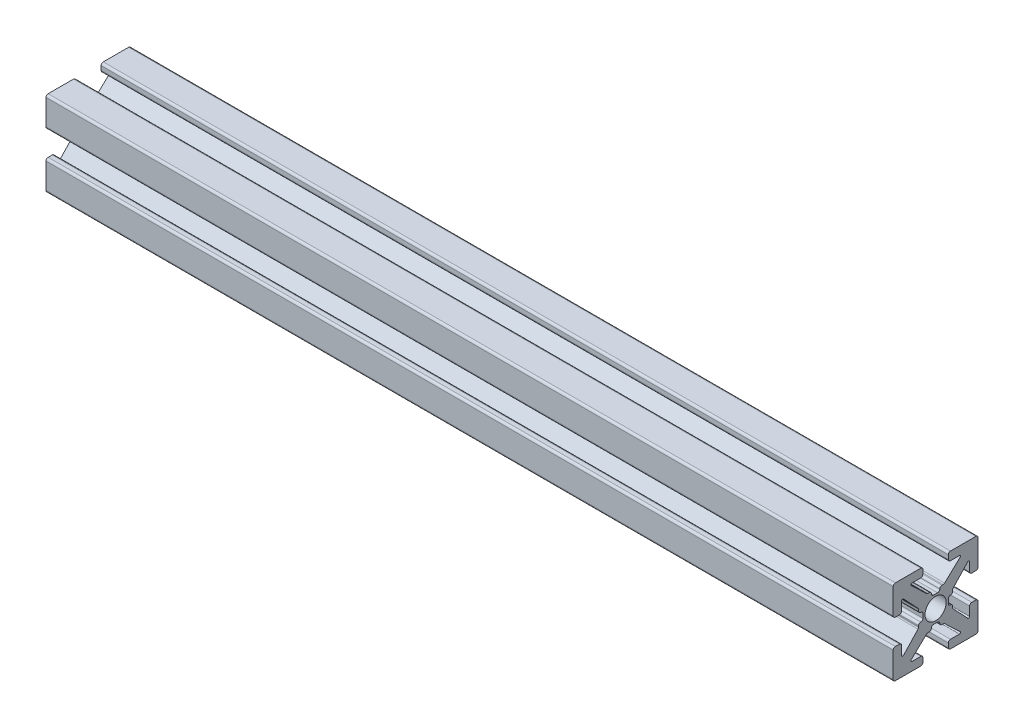
from build123d import *

# Parameters (mm, degrees)
ESTRUSIONE_ESTRUSIONE1_DEPTH = 100
FORO_FILETTATO_M3X0_5_1_D    = 2.5


with BuildPart() as part:
    # Sketch1 → Estrusione-Estrusione1 (new body)
    with BuildSketch(Plane(origin=(0, 0, 0), x_dir=(0, 0, -1), z_dir=(1, 0, 0))):
        with BuildLine():
            Line((-0.2413, 1.4986), (0.2413, 1.4986))
            ThreePointArc((0.2413, 1.4986), (0.420905122, 1.572994878), (0.4953, 1.7526))
            ThreePointArc((0.4953, 1.7526), (0.569694878, 1.932205122), (0.7493, 2.0066))
            Line((0.7493, 2.0066), (0.889923986, 2.0066))
            ThreePointArc((0.889923986, 2.0066), (0.983516259, 2.024471886), (1.063937899, 2.075572548))
            Line((1.063937899, 2.075572548), (2.890793, 3.793686274))
            ThreePointArc((2.890793, 3.793686274), (2.921850101, 3.932996137), (2.803786044, 4.0132))
            Line((2.803786044, 4.0132), (1.7526, 4.0132))
            ThreePointArc((1.7526, 4.0132), (1.572994878, 4.087594878), (1.4986, 4.2672))
            Line((1.4986, 4.2672), (1.4986, 4.7498))
            ThreePointArc((1.4986, 4.7498), (1.572994878, 4.929405122), (1.7526, 5.0038))
            Line((1.7526, 5.0038), (4.7498, 5.0038))
            ThreePointArc((4.7498, 5.0038), (4.929405122, 4.929405122), (5.0038, 4.7498))
            Line((5.0038, 4.7498), (5.0038, 1.7526))
            ThreePointArc((5.0038, 1.7526), (4.929405122, 1.572994878), (4.7498, 1.4986))
            Line((4.7498, 1.4986), (4.2672, 1.4986))
            ThreePointArc((4.2672, 1.4986), (4.087594878, 1.572994878), (4.0132, 1.7526))
            Line((4.0132, 1.7526), (4.0132, 2.803786044))
            ThreePointArc((4.0132, 2.803786044), (3.932996137, 2.921850101), (3.793686274, 2.890793))
            Line((3.793686274, 2.890793), (2.075572548, 1.063937899))
            ThreePointArc((2.075572548, 1.063937899), (2.024471886, 0.983516259), (2.0066, 0.889923986))
            Line((2.0066, 0.889923986), (2.0066, 0.7493))
            ThreePointArc((2.0066, 0.7493), (1.932205122, 0.569694878), (1.7526, 0.4953))
            ThreePointArc((1.7526, 0.4953), (1.572994878, 0.420905122), (1.4986, 0.2413))
            Line((1.4986, 0.2413), (1.4986, -0.2413))
            ThreePointArc((1.4986, -0.2413), (1.572994878, -0.420905122), (1.7526, -0.4953))
            ThreePointArc((1.7526, -0.4953), (1.932205122, -0.569694878), (2.0066, -0.7493))
            Line((2.0066, -0.7493), (2.0066, -0.889923986))
            ThreePointArc((2.0066, -0.889923986), (2.024471886, -0.983516259), (2.075572548, -1.063937899))
            Line((2.075572548, -1.063937899), (3.793686274, -2.890793))
            ThreePointArc((3.793686274, -2.890793), (3.932996137, -2.921850101), (4.0132, -2.803786044))
            Line((4.0132, -2.803786044), (4.0132, -1.7526))
            ThreePointArc((4.0132, -1.7526), (4.087594878, -1.572994878), (4.2672, -1.4986))
            Line((4.2672, -1.4986), (4.7498, -1.4986))
            ThreePointArc((4.7498, -1.4986), (4.929405122, -1.572994878), (5.0038, -1.7526))
            Line((5.0038, -1.7526), (5.0038, -4.7498))
            ThreePointArc((5.0038, -4.7498), (4.929405122, -4.929405122), (4.7498, -5.0038))
            Line((4.7498, -5.0038), (1.7526, -5.0038))
            ThreePointArc((1.7526, -5.0038), (1.572994878, -4.929405122), (1.4986, -4.7498))
            Line((1.4986, -4.7498), (1.4986, -4.2672))
            ThreePointArc((1.4986, -4.2672), (1.572994878, -4.087594878), (1.7526, -4.0132))
            Line((1.7526, -4.0132), (2.803786044, -4.0132))
            ThreePointArc((2.803786044, -4.0132), (2.921850101, -3.932996137), (2.890793, -3.793686274))
            Line((2.890793, -3.793686274), (1.063937899, -2.075572548))
            ThreePointArc((1.063937899, -2.075572548), (0.983516259, -2.024471886), (0.889923986, -2.0066))
            Line((0.889923986, -2.0066), (0.7493, -2.0066))
            ThreePointArc((0.7493, -2.0066), (0.569694878, -1.932205122), (0.4953, -1.7526))
            ThreePointArc((0.4953, -1.7526), (0.420905122, -1.572994878), (0.2413, -1.4986))
            Line((0.2413, -1.4986), (-0.2413, -1.4986))
            ThreePointArc((-0.2413, -1.4986), (-0.420905122, -1.572994878), (-0.4953, -1.7526))
            ThreePointArc((-0.4953, -1.7526), (-0.569694878, -1.932205122), (-0.7493, -2.0066))
            Line((-0.7493, -2.0066), (-0.889923986, -2.0066))
            ThreePointArc((-0.889923986, -2.0066), (-0.983516259, -2.024471886), (-1.063937899, -2.075572548))
            Line((-1.063937899, -2.075572548), (-2.890793, -3.793686274))
            ThreePointArc((-2.890793, -3.793686274), (-2.921850101, -3.932996137), (-2.803786044, -4.0132))
            Line((-2.803786044, -4.0132), (-1.7526, -4.0132))
            ThreePointArc((-1.7526, -4.0132), (-1.572994878, -4.087594878), (-1.4986, -4.2672))
            Line((-1.4986, -4.2672), (-1.4986, -4.7498))
            ThreePointArc((-1.4986, -4.7498), (-1.572994878, -4.929405122), (-1.7526, -5.0038))
            Line((-1.7526, -5.0038), (-4.7498, -5.0038))
            ThreePointArc((-4.7498, -5.0038), (-4.929405122, -4.929405122), (-5.0038, -4.7498))
            Line((-5.0038, -4.7498), (-5.0038, -1.7526))
            ThreePointArc((-5.0038, -1.7526), (-4.929405122, -1.572994878), (-4.7498, -1.4986))
            Line((-4.7498, -1.4986), (-4.2672, -1.4986))
            ThreePointArc((-4.2672, -1.4986), (-4.087594878, -1.572994878), (-4.0132, -1.7526))
            Line((-4.0132, -1.7526), (-4.0132, -2.803786044))
            ThreePointArc((-4.0132, -2.803786044), (-3.932996137, -2.921850101), (-3.793686274, -2.890793))
            Line((-3.793686274, -2.890793), (-2.075572548, -1.063937899))
            ThreePointArc((-2.075572548, -1.063937899), (-2.024471886, -0.983516259), (-2.0066, -0.889923986))
            Line((-2.0066, -0.889923986), (-2.0066, -0.7493))
            ThreePointArc((-2.0066, -0.7493), (-1.932205122, -0.569694878), (-1.7526, -0.4953))
            ThreePointArc((-1.7526, -0.4953), (-1.572994878, -0.420905122), (-1.4986, -0.2413))
            Line((-1.4986, -0.2413), (-1.4986, 0.2413))
            ThreePointArc((-1.4986, 0.2413), (-1.572994878, 0.420905122), (-1.7526, 0.4953))
            ThreePointArc((-1.7526, 0.4953), (-1.932205122, 0.569694878), (-2.0066, 0.7493))
            Line((-2.0066, 0.7493), (-2.0066, 0.889923986))
            ThreePointArc((-2.0066, 0.889923986), (-2.024471886, 0.983516259), (-2.075572548, 1.063937899))
            Line((-2.075572548, 1.063937899), (-3.793686274, 2.890793))
            ThreePointArc((-3.793686274, 2.890793), (-3.932996137, 2.921850101), (-4.0132, 2.803786044))
            Line((-4.0132, 2.803786044), (-4.0132, 1.7526))
            ThreePointArc((-4.0132, 1.7526), (-4.087594878, 1.572994878), (-4.2672, 1.4986))
            Line((-4.2672, 1.4986), (-4.7498, 1.4986))
            ThreePointArc((-4.7498, 1.4986), (-4.929405122, 1.572994878), (-5.0038, 1.7526))
            Line((-5.0038, 1.7526), (-5.0038, 4.7498))
            ThreePointArc((-5.0038, 4.7498), (-4.929405122, 4.929405122), (-4.7498, 5.0038))
            Line((-4.7498, 5.0038), (-1.7526, 5.0038))
            ThreePointArc((-1.7526, 5.0038), (-1.572994878, 4.929405122), (-1.4986, 4.7498))
            Line((-1.4986, 4.7498), (-1.4986, 4.2672))
            ThreePointArc((-1.4986, 4.2672), (-1.572994878, 4.087594878), (-1.7526, 4.0132))
            Line((-1.7526, 4.0132), (-2.803786044, 4.0132))
            ThreePointArc((-2.803786044, 4.0132), (-2.921850101, 3.932996137), (-2.890793, 3.793686274))
            Line((-2.890793, 3.793686274), (-1.063937899, 2.075572548))
            ThreePointArc((-1.063937899, 2.075572548), (-0.983516259, 2.024471886), (-0.889923986, 2.0066))
            Line((-0.889923986, 2.0066), (-0.7493, 2.0066))
            ThreePointArc((-0.7493, 2.0066), (-0.569694878, 1.932205122), (-0.4953, 1.7526))
            ThreePointArc((-0.4953, 1.7526), (-0.420905122, 1.572994878), (-0.2413, 1.4986))
        make_face()
    extrude(amount=ESTRUSIONE_ESTRUSIONE1_DEPTH)

    # Foro filettato M3x0.5-1 (through all)
    with Locations(Plane.ZY):
        with Locations((0, 0)):
            Hole(FORO_FILETTATO_M3X0_5_1_D / 2)


solid = part.part
